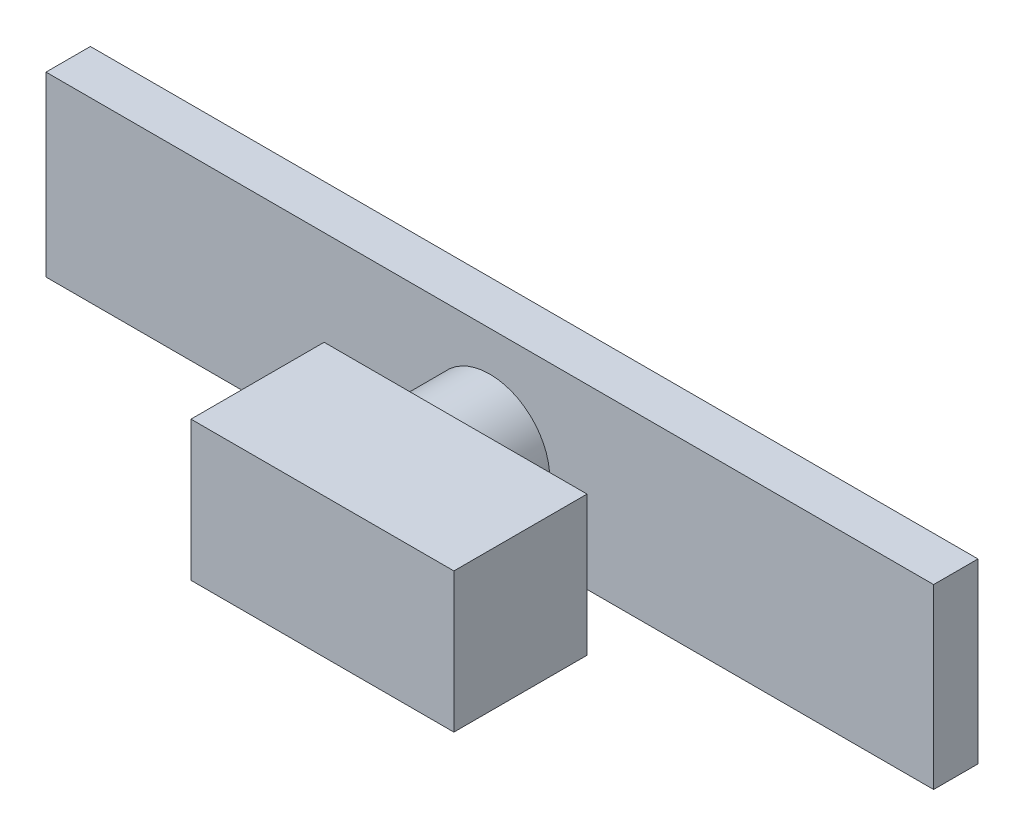
from build123d import *

# Parameters (mm, degrees)
SKETCH2_W             = 254
SKETCH2_H             = 12.7
BOSS_EXTRUDE1_DEPTH   = 50.8
SKETCH3_R             = 17.140791438
BOSS_EXTRUDE2_DEPTH   = 19.05
SKETCH4_W             = 75.235944222
SKETCH4_H             = 39.955088207
BOSS_EXTRUDE3_DEPTH   = 38.1
SCALE2_SCALE          = 0.06
BODY_MOVE_COPY1_ANGLE = 90
SCALE5_SCALE          = 0.25
SCALE6_SCALE          = 0.25


with BuildPart() as part:
    # Sketch2 → Boss-Extrude1 (new body)
    with BuildSketch(Plane.XY):
        with Locations((79.130769231, 14.898076923)):
            Rectangle(SKETCH2_W, SKETCH2_H)
    extrude(amount=BOSS_EXTRUDE1_DEPTH)

    # Sketch3 → Boss-Extrude2 (add)
    with BuildSketch(Plane(origin=(0, 21.248076923, 0), x_dir=(1, 0, 0), z_dir=(0, 1, 0))):
        with Locations((79.130769231, -28.483063876)):
            Circle(SKETCH3_R)
    extrude(amount=BOSS_EXTRUDE2_DEPTH)

    # Sketch4 → Boss-Extrude3 (add)
    with BuildSketch(Plane(origin=(0, 40.298076923, 0), x_dir=(1, 0, 0), z_dir=(0, 1, 0))):
        with Locations((88.38546847, -28.088530296)):
            Rectangle(SKETCH4_W, SKETCH4_H)
    extrude(amount=BOSS_EXTRUDE3_DEPTH)


with BuildPart() as part_1:
    # Scale2: scaled about (82.711857342, 33.041003565, 26.623476887)
    add(part.part.scale(SCALE2_SCALE).moved(Location((77.749145901, 31.058543351, 25.026068274))))


with BuildPart() as part_2:
    # Body-Move/Copy1: moved
    add(part_1.part.rotate(Axis((0, 33.666927966, 26.550068274), (1, 0, 0)), BODY_MOVE_COPY1_ANGLE))


with BuildPart() as part_3:
    # Body-Move/Copy3: moved
    add(part_2.part.moved(Location((-50.8, 0, -50.8))))


with BuildPart() as part_4:
    # Scale5: scaled about (31.911857342, 33.593519353, -24.875856127)
    add(part_3.part.scale(SCALE5_SCALE).moved(Location((23.933893006, 25.195139515, -18.656892095))))


with BuildPart() as part_5:
    # Body-Move/Copy9: moved
    add(part_4.part.moved(Location((-50.8, 0, 0))))


with BuildPart() as part_6:
    # Body-Move/Copy13: moved
    add(part_5.part.moved(Location((0, -50.8, 0))))


with BuildPart() as part_7:
    # Scale6: scaled about (-18.888142658, -17.206480647, -24.875856127)
    add(part_6.part.scale(SCALE6_SCALE).moved(Location((-14.166106993, -12.904860485, -18.656892095))))


with BuildPart() as part_8:
    # Body-Move/Copy16: moved
    add(part_7.part.moved(Location((0, 0, -12.7))))


solid = part_8.part
